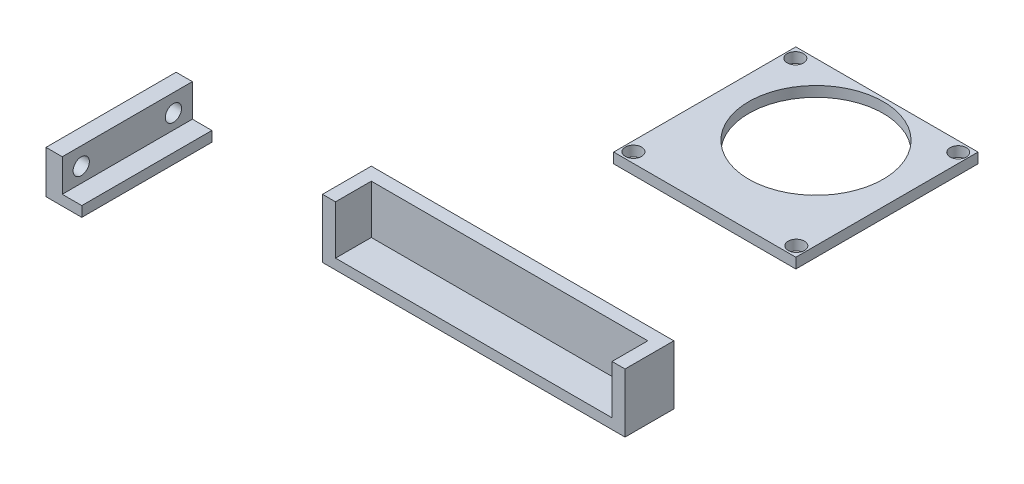
from build123d import *

# Parameters (mm, degrees)
SKETCH2_W           = 59.055
SKETCH2_H           = 25.4
BOSS_EXTRUDE1_DEPTH = 2
BOSS_EXTRUDE2_START = 2
BOSS_EXTRUDE2_DEPTH = 9.525
SKETCH3_W           = 38.1
SKETCH3_H           = 25.4
BOSS_EXTRUDE3_DEPTH = 2
BOSS_EXTRUDE4_START = 2
SKETCH4_W           = 3.175
SKETCH4_H           = 25.4
BOSS_EXTRUDE4_DEPTH = 6.35
SKETCH5_R           = 1.5875
CUT_EXTRUDE1_DEPTH  = 3.175
SKETCH6_W           = 35.56
SKETCH6_H           = 71.12
SKETCH6_R           = 1.5875
BOSS_EXTRUDE5_DEPTH = 2
FILLET1_R           = 2.54
SKETCH10_R          = 13.129221829
CUT_EXTRUDE2_DEPTH  = 2
SPLIT3_START        = -40.64
SPLIT3_OUTLINE_W    = 2
SPLIT3_OUTLINE_H    = 25.4
SPLIT3_DEPTH        = 38.1
SPLIT3_2_OUTLINE_W  = 6.35
SPLIT3_2_OUTLINE_H  = 25.4
SPLIT3_2_OUTLINE_R  = 1.5875
SPLIT3_2_DEPTH      = 3.175
SPLIT3_3_OUTLINE_W  = 8.35
SPLIT3_3_OUTLINE_H  = 25.4
SPLIT3_3_OUTLINE_R  = 1.5875
SPLIT3_3_DEPTH      = 38.1
SPLIT3_START_2      = 56.515
SPLIT3_4_OUTLINE_W  = 8.35
SPLIT3_4_OUTLINE_H  = 25.4
SPLIT3_4_OUTLINE_R  = 1.5875
SPLIT3_4_DEPTH      = 38.1
SPLIT3_5_OUTLINE_W  = 2
SPLIT3_5_OUTLINE_H  = 25.4
SPLIT3_5_DEPTH      = 38.1
SPLIT3_START_3      = 91.44
SPLIT3_6_OUTLINE_W  = 6.35
SPLIT3_6_OUTLINE_H  = 25.4
SPLIT3_6_OUTLINE_R  = 1.5875
SPLIT3_6_DEPTH      = 3.175


# Read off the part's stored shape, not the designer's step: Split3, Split4
with BuildPart() as part:
    # Sketch2 → Boss-Extrude1 (new body)
    with BuildSketch(Plane(origin=(0, 0, 0), x_dir=(1, 0, 0), z_dir=(0, 1, 0))):
        with Locations((26.9875, 154.94)):
            Rectangle(SKETCH2_W, SKETCH2_H)
    extrude(amount=BOSS_EXTRUDE1_DEPTH)

    # Sketch1 → Boss-Extrude2 (add)
    with BuildSketch(Plane(origin=(0, 0, 0), x_dir=(1, 0, 0), z_dir=(0, 1, 0)).offset(BOSS_EXTRUDE2_START)):
        Polygon((-2.54, 167.64), (-2.54, 158.115), (0, 158.115), (0, 165.1), (53.975, 165.1), (53.975, 158.115), (56.515, 158.115), (56.515, 167.64), align=None)
    extrude(amount=BOSS_EXTRUDE2_DEPTH)

    # Sketch3 → Boss-Extrude3 (add)
    with BuildSketch(Plane(origin=(0, 0, 0), x_dir=(1, 0, 0), z_dir=(0, 1, 0))):
        with Locations((75.565, 154.94)):
            Rectangle(SKETCH3_W, SKETCH3_H)
    extrude(amount=BOSS_EXTRUDE3_DEPTH)

    # Sketch4 → Boss-Extrude4 (add)
    with BuildSketch(Plane(origin=(0, 0, 0), x_dir=(1, 0, 0), z_dir=(0, 1, 0)).offset(BOSS_EXTRUDE4_START)):
        with Locations((93.0275, 154.94)):
            Rectangle(SKETCH4_W, SKETCH4_H)
    extrude(amount=BOSS_EXTRUDE4_DEPTH)

    # Sketch5 → Cut-Extrude1 (cut)
    with BuildSketch(Plane(origin=(94.615, 0, 0), x_dir=(0, 0, -1), z_dir=(1, 0, 0))):
        with Locations((145.94, 4.895971622)):
            Circle(SKETCH5_R)
        with Locations(Location((163.94, 4.895971622, 0), (0, 0, 180))):
            Circle(SKETCH5_R)
    extrude(amount=-CUT_EXTRUDE1_DEPTH, mode=Mode.SUBTRACT)

    # Mirror1: part across plane


with BuildPart() as part_1:
    add(part.part)
    add(part.part.mirror(Plane(origin=(26.9875, 0, 0), x_dir=(0, 0, 1), z_dir=(1, 0, 0))))

    # Sketch6 → Boss-Extrude5 (add)
    with BuildSketch(Plane(origin=(0, 0, 0), x_dir=(1, 0, 0), z_dir=(0, 1, 0))):
        with Locations((26.9875, 203.2)):
            Rectangle(SKETCH6_W, SKETCH6_H)
        with Locations(Location((11.09051688, 236.783908574, 0), (0, 0, 270))):
            Circle(SKETCH6_R, mode=Mode.SUBTRACT)
        with Locations(Location((11.09051688, 205.176091426, 0), (0, 0, 90))):
            Circle(SKETCH6_R, mode=Mode.SUBTRACT)
        with Locations(Location((42.88448312, 205.176091426, 0), (0, 0, 270))):
            Circle(SKETCH6_R, mode=Mode.SUBTRACT)
        with Locations(Location((42.88448312, 236.783908574, 0), (0, 0, 90))):
            Circle(SKETCH6_R, mode=Mode.SUBTRACT)
    extrude(amount=BOSS_EXTRUDE5_DEPTH)

    # Fillet1
    fillet1_edges = [part_1.edges().sort_by_distance(p)[0] for p in [
        (26.9875, 2, -167.64),
    ]]
    fillet(fillet1_edges, radius=FILLET1_R)

    # Sketch10 → Cut-Extrude2 (cut)
    with BuildSketch(Plane(origin=(0, 2, 0), x_dir=(1, 0, 0), z_dir=(0, 1, 0))):
        with Locations(Location((26.9875, 224.917, 0), (0, 0, 270))):
            Circle(SKETCH10_R)
    extrude(amount=-CUT_EXTRUDE2_DEPTH, mode=Mode.SUBTRACT)


with BuildPart() as body_2:
    # Split1: the piece on the far side of the plane
    add(part_1.part)
    split(bisect_by=Plane(origin=(0, 0, -167.64), x_dir=(-1, 0, 0), z_dir=(0, 0, -1)), keep=Keep.BOTTOM)

    # Split3 3 outline → Split3 3 (cut)
    with BuildSketch(Plane.YZ.offset(SPLIT3_START)):
        with Locations((4.175, -154.94)):
            Rectangle(SPLIT3_3_OUTLINE_W, SPLIT3_3_OUTLINE_H)
        with Locations((4.895971622, -145.94)):
            Circle(SPLIT3_3_OUTLINE_R, mode=Mode.SUBTRACT)
        with Locations((4.895971622, -163.94)):
            Circle(SPLIT3_3_OUTLINE_R, mode=Mode.SUBTRACT)
    extrude(amount=SPLIT3_3_DEPTH, mode=Mode.SUBTRACT)

    # Split3 4 outline → Split3 4 (cut)
    with BuildSketch(Plane.YZ.offset(SPLIT3_START_2)):
        with Locations((4.175, -154.94)):
            Rectangle(SPLIT3_4_OUTLINE_W, SPLIT3_4_OUTLINE_H)
        with Locations((4.895971622, -145.94)):
            Circle(SPLIT3_4_OUTLINE_R, mode=Mode.SUBTRACT)
        with Locations((4.895971622, -163.94)):
            Circle(SPLIT3_4_OUTLINE_R, mode=Mode.SUBTRACT)
    extrude(amount=SPLIT3_4_DEPTH, mode=Mode.SUBTRACT)


with BuildPart() as part_2:
    add(part_1.part)

    # Split1
    split(bisect_by=Plane(origin=(0, 0, -167.64), x_dir=(-1, 0, 0), z_dir=(0, 0, -1)), keep=Keep.TOP)


with BuildPart() as body_3:
    # Split2: the piece on the far side of the plane
    add(part_2.part)
    split(bisect_by=Plane(origin=(0, 0, -203.2), x_dir=(-1, 0, 0), z_dir=(0, 0, -1)), keep=Keep.BOTTOM)


with BuildPart() as part_3:
    add(part_2.part)

    # Split2
    split(bisect_by=Plane(origin=(0, 0, -203.2), x_dir=(-1, 0, 0), z_dir=(0, 0, -1)), keep=Keep.TOP)


with BuildPart() as body_3_2:
    # Split3 outline → Split3 (new body)
    with BuildSketch(Plane.YZ.offset(SPLIT3_START)):
        with Locations((1, -154.94)):
            Rectangle(SPLIT3_OUTLINE_W, SPLIT3_OUTLINE_H)
    extrude(amount=SPLIT3_DEPTH)

    # Split3 2 outline → Split3 2 (add)
    with BuildSketch(Plane.YZ.offset(SPLIT3_START)):
        with Locations((5.175, -154.94)):
            Rectangle(SPLIT3_2_OUTLINE_W, SPLIT3_2_OUTLINE_H)
        with Locations((4.895971622, -163.94)):
            Circle(SPLIT3_2_OUTLINE_R, mode=Mode.SUBTRACT)
        with Locations((4.895971622, -145.94)):
            Circle(SPLIT3_2_OUTLINE_R, mode=Mode.SUBTRACT)
    extrude(amount=SPLIT3_2_DEPTH)


with BuildPart() as body_4:
    # Split3 5 outline → Split3 5 (new body)
    with BuildSketch(Plane.YZ.offset(SPLIT3_START_2)):
        with Locations((1, -154.94)):
            Rectangle(SPLIT3_5_OUTLINE_W, SPLIT3_5_OUTLINE_H)
    extrude(amount=SPLIT3_5_DEPTH)

    # Split3 6 outline → Split3 6 (add)
    with BuildSketch(Plane.YZ.offset(SPLIT3_START_3)):
        with Locations((5.175, -154.94)):
            Rectangle(SPLIT3_6_OUTLINE_W, SPLIT3_6_OUTLINE_H)
        with Locations((4.895971622, -163.94)):
            Circle(SPLIT3_6_OUTLINE_R, mode=Mode.SUBTRACT)
        with Locations((4.895971622, -145.94)):
            Circle(SPLIT3_6_OUTLINE_R, mode=Mode.SUBTRACT)
    extrude(amount=SPLIT3_6_DEPTH)


with BuildPart() as body_4_2:
    # Split4: the piece on the far side of the plane
    add(body_2.part)
    split(bisect_by=Plane.XY.offset(-158.115), keep=Keep.BOTTOM)


with BuildPart() as body_2_1:
    add(body_2.part)

    # Split4
    split(bisect_by=Plane.XY.offset(-158.115), keep=Keep.TOP)


with BuildPart() as body_4_3:
    # Split5: the piece on the far side of the plane
    add(body_3_2.part)
    split(bisect_by=Plane(origin=(-33.655, 0, 0), x_dir=(0, 0, 1), z_dir=(1, 0, 0)), keep=Keep.BOTTOM)


with BuildPart() as body_3_2_1:
    add(body_3_2.part)

    # Split5
    split(bisect_by=Plane(origin=(-33.655, 0, 0), x_dir=(0, 0, 1), z_dir=(1, 0, 0)), keep=Keep.TOP)


solid = Compound([part_3.part, body_4_2.part, body_4_3.part])
